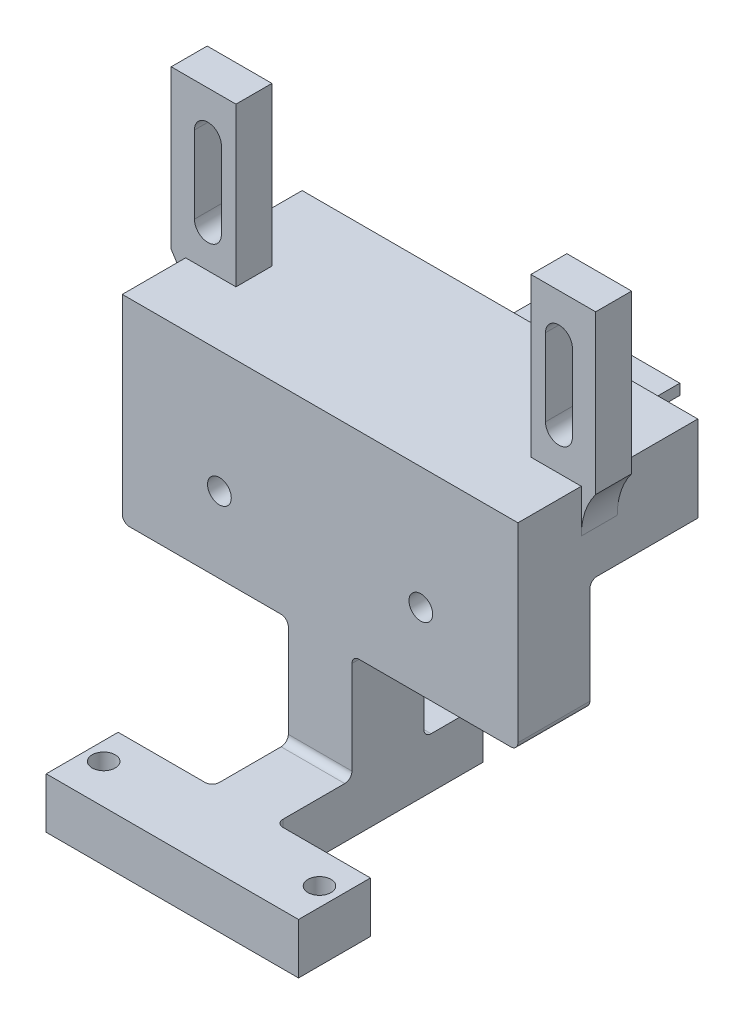
from build123d import *

# Parameters (mm, degrees)
SKETCH_1_W            = 35
SKETCH_1_H            = 40
EXTRUDE_1_DEPTH       = 5
SKETCH_2_W            = 20
SKETCH_2_H            = 20
EXTRUDE_2_DEPTH       = 65
SKETCH_3_W            = 56
SKETCH_3_H            = 11
SKETCH_3_W_2          = 4.5
CUT_EXTRUDE_1_DEPTH   = 78.821912081
SKETCH_5_W            = 55
SKETCH_5_H            = 20
EXTRUDE_3_DEPTH       = 25
SKETCH_9_R            = 1.65
CUT_EXTRUDE_3_DEPTH   = 27
SKETCH_10_W           = 55
SKETCH_10_H           = 25
EXTRUDE_4_DEPTH       = 4.9
SKETCH_11_W           = 7
SKETCH_11_H           = 5
EXTRUDE_5_DEPTH       = 21
CHAMFER_2_SIZE        = 10
CHAMFER_3_SIZE        = 3
CHAMFER_4_SIZE        = 2
CUT_EXTRUDE_7_DEPTH   = 15
SKETCH_16_W           = 12.984556049
SKETCH_16_H           = 11
EXTRUDE_6_DEPTH       = 20
CHAMFER_5_SIZE        = 3
SKETCH_19_R           = 1.6
CUT_EXTRUDE_10_DEPTH  = 10
FILLET_1_R            = 5
SKETCH_20_W           = 5
SKETCH_20_H           = 22.5
EXTRUDE_7_DEPTH       = 17.5
SKETCH_21_W           = 5
SKETCH_21_H           = 22.5
EXTRUDE_8_DEPTH       = 5
SKETCH_22_W           = 5
SKETCH_22_H           = 22.5
EXTRUDE_9_DEPTH       = 10
SKETCH_23_W           = 5
SKETCH_23_H           = 22.5
EXTRUDE_10_DEPTH      = 10
SKETCH_24_W           = 3.3
SKETCH_24_H           = 22.5
EXTRUDE_11_DEPTH      = 4
SKETCH_26_W           = 5
SKETCH_26_H           = 22.5
EXTRUDE_13_DEPTH      = 17.5
SKETCH_27_W           = 5
SKETCH_27_H           = 22.5
EXTRUDE_14_DEPTH      = 5
SKETCH_28_W           = 5
SKETCH_28_H           = 22.5
EXTRUDE_15_DEPTH      = 10
SKETCH_29_W           = 5
SKETCH_29_H           = 22.5
EXTRUDE_16_DEPTH      = 10
SKETCH_31_W           = 3.4
SKETCH_31_H           = 22.5
EXTRUDE_18_DEPTH      = 4
SKETCH_39_W           = 7.13678645
SKETCH_39_H           = 13.518332953
SKETCH_39_W_2         = 8.139264071
SKETCH_39_H_2         = 10.52230198
CUT_EXTRUDE_17_DEPTH  = 35
SKETCH_40_W           = 55
SKETCH_40_H           = 10
EXTRUDE_20_DEPTH      = 25.575713879
SKETCH_41_W           = 8.84873954
SKETCH_41_H           = 7.046133319
EXTRUDE_21_DEPTH      = 20.577981656
EXTRUDE_22_DEPTH      = 13.07563
EXTRUDE_22_DEPTH_BACK = 22
SKETCH_42_W           = 38.79276714
SKETCH_42_H           = 7.046133319
SKETCH_43_W           = 23.07563023
SKETCH_43_H           = 28.79276714
CUT_EXTRUDE_18_DEPTH  = 22
FILLET_3_R            = 1
SKETCH_46_W           = 9.238205764
SKETCH_46_H           = 22.5
EXTRUDE_26_DEPTH      = 10
CUT_EXTRUDE_19_DEPTH  = 10
SKETCH_48_R           = 1.6
CUT_EXTRUDE_20_DEPTH  = 10
CUT_EXTRUDE_21_DEPTH  = 10
SKETCH_50_W           = 2.57104036
SKETCH_50_H           = 22.5
SKETCH_50_W_2         = 2.865096637
EXTRUDE_27_DEPTH      = 10
SKETCH_53_W           = 4.304606657
SKETCH_53_H           = 10
SKETCH_53_W_2         = 2.865096637
EXTRUDE_28_DEPTH      = 11
SKETCH_51_R           = 1.6
CUT_EXTRUDE_22_DEPTH  = 12
SKETCH_52_W           = 17.2
SKETCH_52_H           = 6.8
CUT_EXTRUDE_23_DEPTH  = 39
CUT_EXTRUDE_24_DEPTH  = 10
SKETCH_55_W           = 32
SKETCH_55_H           = 22.5
EXTRUDE_29_DEPTH      = 12
SKETCH_56_W           = 10.301119562
SKETCH_56_H           = 22.5
CUT_EXTRUDE_25_DEPTH  = 7
SKETCH_57_W           = 3
SKETCH_57_H           = 4.95
EXTRUDE_30_DEPTH      = 8
SKETCH_58_W           = 9
SKETCH_58_H           = 22.5
SKETCH_58_W_2         = 8.434386946
CUT_EXTRUDE_26_DEPTH  = 10.05
CUT_EXTRUDE_27_DEPTH  = 1
SKETCH_60_W           = 2.55
SKETCH_60_H           = 22.5
EXTRUDE_31_DEPTH      = 12
SKETCH_61_W           = 3.965384327
SKETCH_61_H           = 22.5
CUT_EXTRUDE_28_DEPTH  = 6.95
SKETCH_62_W           = 5
SKETCH_62_H           = 22
EXTRUDE_32_DEPTH      = 2
SKETCH_63_W           = 5
SKETCH_63_H           = 22
EXTRUDE_33_DEPTH      = 2
SKETCH_64_W           = 5
SKETCH_64_H           = 22.5
EXTRUDE_34_DEPTH      = 8
SKETCH_65_W           = 0.1
SKETCH_65_H           = 22.5
CUT_EXTRUDE_30_DEPTH  = 15
SKETCH_66_W           = 5
SKETCH_66_H           = 22.5
EXTRUDE_35_DEPTH      = 8
SKETCH_67_R           = 1.1
CUT_EXTRUDE_31_DEPTH  = 9
SKETCH_68_W           = 0.1
SKETCH_68_H           = 22.5
CUT_EXTRUDE_32_DEPTH  = 12
SKETCH_69_W           = 12
SKETCH_69_H           = 22.5
EXTRUDE_36_DEPTH      = 5
SKETCH_70_W           = 107.728068616
SKETCH_70_H           = 75.066227262
CUT_EXTRUDE_33_DEPTH  = 130
SKETCH_73_W           = 6.7
SKETCH_73_H           = 9
CUT_EXTRUDE_34_DEPTH  = 15
FILLET_5_R            = 10
SKETCH_75_W           = 20
SKETCH_75_H           = 11.957252994
SKETCH_75_W_2         = 6.7
SKETCH_75_H_2         = 9
EXTRUDE_38_DEPTH      = 15
CUT_EXTRUDE_35_DEPTH  = 20
CUT_EXTRUDE_36_DEPTH  = 25
FILLET_6_R            = 10
CHAMFER_6_SIZE        = 5


with BuildPart() as part:
    # 草图1 → 凸台-拉伸1 (new body)
    with BuildSketch(Plane.XY):
        Rectangle(SKETCH_1_W, SKETCH_1_H)
    extrude(amount=EXTRUDE_1_DEPTH)

    # 草图2 → 凸台-拉伸2 (add)
    with BuildSketch(Plane.XY.offset(5)):
        Rectangle(SKETCH_2_W, SKETCH_2_H)
    extrude(amount=EXTRUDE_2_DEPTH)

    # 草图3 → 切除-拉伸1 (cut, through all)
    with BuildSketch(Plane.ZY.offset(10)):
        with Locations((37.5, 0)):
            Rectangle(SKETCH_3_W, SKETCH_3_H)
        with Locations((7.25, 0)):
            Rectangle(SKETCH_3_W_2, SKETCH_3_H)
    extrude(amount=-CUT_EXTRUDE_1_DEPTH, mode=Mode.SUBTRACT)

    # 草图5 → 凸台-拉伸3 (add)
    with BuildSketch(Plane.XY.offset(70)):
        Rectangle(SKETCH_5_W, SKETCH_5_H)
    extrude(amount=EXTRUDE_3_DEPTH)

    # 草图9 → 切除-拉伸3 (cut)
    with BuildSketch(Plane.XY.offset(95)):
        with Locations((-14, -3.042747006)):
            Circle(SKETCH_9_R)
        with Locations((14, -3.042747006)):
            Circle(SKETCH_9_R)
    extrude(amount=-CUT_EXTRUDE_3_DEPTH, mode=Mode.SUBTRACT)

    # 草图10 → 凸台-拉伸4 (add)
    with BuildSketch(Plane(origin=(0, 10, 0), x_dir=(1, 0, 0), z_dir=(0, 1, 0))):
        with Locations((0, -82.5)):
            Rectangle(SKETCH_10_W, SKETCH_10_H)
    extrude(amount=EXTRUDE_4_DEPTH)

    # 草图11 → 凸台-拉伸5 (add)
    with BuildSketch(Plane(origin=(0, 14.9, 0), x_dir=(1, 0, 0), z_dir=(0, 1, 0))):
        with Locations((-24, -83.7)):
            Rectangle(SKETCH_11_W, SKETCH_11_H)
        with Locations((24, -83.7)):
            Rectangle(SKETCH_11_W, SKETCH_11_H)
    extrude(amount=EXTRUDE_5_DEPTH)

    # 倒角2
    chamfer_2_edges = [part.edges().sort_by_distance(p)[0] for p in [
        (0, -5.5, 65.5),
    ]]
    chamfer(chamfer_2_edges, length=CHAMFER_2_SIZE)

    # 倒角3
    chamfer_3_edges = [part.edges().sort_by_distance(p)[0] for p in [
        (0, 10, 70),
    ]]
    chamfer(chamfer_3_edges, length=CHAMFER_3_SIZE)

    # 倒角4
    chamfer_4_edges = [part.edges().sort_by_distance(p)[0] for p in [
        (0, -10, 5),
    ]]
    chamfer(chamfer_4_edges, length=CHAMFER_4_SIZE)

    # 草图15 → 切除-拉伸7 (cut)
    with BuildSketch(Plane(origin=(0, 0, 70), x_dir=(-1, 0, 0), z_dir=(0, 0, -1))):
        Polygon((10, 1.957252994), (29.13083687, 1.957252994), (29.13083687, -8.042747006), (29.13083687, -10), (10, -10), (10, -8.042747006), align=None)
        Polygon((-29.13083687, 1.957252994), (-29.13083687, -8.042747006), (-29.13083687, -10), (-10, -10), (-10, -8.042747006), (-10, 1.957252994), align=None)
    extrude(amount=-CUT_EXTRUDE_7_DEPTH, mode=Mode.SUBTRACT)

    # 草图16 → 凸台-拉伸6 (add)
    with BuildSketch(Plane.ZY.offset(10)):
        with Locations((11.492278025, 0)):
            Rectangle(SKETCH_16_W, SKETCH_16_H)
    extrude(amount=-EXTRUDE_6_DEPTH)

    # 倒角5
    chamfer_5_edges = [part.edges().sort_by_distance(p)[0] for p in [
        (0, 5.5, 17.984556049),
    ]]
    chamfer(chamfer_5_edges, length=CHAMFER_5_SIZE)

    # 草图19 → 切除-拉伸10 (cut)
    with BuildSketch(Plane.XY.offset(86.2)):
        with Locations((-24.4, 29.9)):
            Circle(SKETCH_19_R)
        with Locations((-24.4, 19.9)):
            Circle(SKETCH_19_R)
        with Locations((24.4, 19.9)):
            Circle(SKETCH_19_R)
        with Locations((24.4, 29.9)):
            Circle(SKETCH_19_R)
    extrude(amount=-CUT_EXTRUDE_10_DEPTH, mode=Mode.SUBTRACT)

    # 圆角1
    fillet_1_edges = [part.edges().sort_by_distance(p)[0] for p in [
        (17.5, -20, 2.5),
        (-17.5, -20, 2.5),
        (-17.5, 20, 2.5),
        (17.5, 20, 2.5),
    ]]
    fillet(fillet_1_edges, radius=FILLET_1_R)

    # 草图20 → 凸台-拉伸7 (add)
    with BuildSketch(Plane.ZY.offset(17.5)):
        with Locations((2.5, 0)):
            Rectangle(SKETCH_20_W, SKETCH_20_H)
    extrude(amount=EXTRUDE_7_DEPTH)

    # 草图21 → 凸台-拉伸8 (add)
    with BuildSketch(Plane.ZY.offset(35)):
        with Locations((2.5, 0)):
            Rectangle(SKETCH_21_W, SKETCH_21_H)
    extrude(amount=EXTRUDE_8_DEPTH)

    # 草图22 → 凸台-拉伸9 (add)
    with BuildSketch(Plane(origin=(0, 0, 0), x_dir=(-1, 0, 0), z_dir=(0, 0, -1))):
        with Locations((37.5, 0)):
            Rectangle(SKETCH_22_W, SKETCH_22_H)
    extrude(amount=EXTRUDE_9_DEPTH)

    # 草图23 → 凸台-拉伸10 (add)
    with BuildSketch(Plane(origin=(0, 0, 0), x_dir=(-1, 0, 0), z_dir=(0, 0, -1))):
        with Locations((15.5, 0)):
            Rectangle(SKETCH_23_W, SKETCH_23_H)
    extrude(amount=EXTRUDE_10_DEPTH)

    # 草图24 → 凸台-拉伸11 (add)
    with BuildSketch(Plane.ZY.offset(18)):
        with Locations((-8.35, 0)):
            Rectangle(SKETCH_24_W, SKETCH_24_H)
    extrude(amount=EXTRUDE_11_DEPTH)

    # 草图26 → 凸台-拉伸13 (add)
    with BuildSketch(Plane(origin=(17.5, 0, 0), x_dir=(0, 0, -1), z_dir=(1, 0, 0))):
        with Locations((-2.5, 0)):
            Rectangle(SKETCH_26_W, SKETCH_26_H)
    extrude(amount=EXTRUDE_13_DEPTH)

    # 草图27 → 凸台-拉伸14 (add)
    with BuildSketch(Plane(origin=(35, 0, 0), x_dir=(0, 0, -1), z_dir=(1, 0, 0))):
        with Locations((-2.5, 0)):
            Rectangle(SKETCH_27_W, SKETCH_27_H)
    extrude(amount=EXTRUDE_14_DEPTH)

    # 草图28 → 凸台-拉伸15 (add)
    with BuildSketch(Plane(origin=(0, 0, 0), x_dir=(-1, 0, 0), z_dir=(0, 0, -1))):
        with Locations((-37.5, 0)):
            Rectangle(SKETCH_28_W, SKETCH_28_H)
    extrude(amount=EXTRUDE_15_DEPTH)

    # 草图29 → 凸台-拉伸16 (add)
    with BuildSketch(Plane(origin=(0, 0, 0), x_dir=(-1, 0, 0), z_dir=(0, 0, -1))):
        with Locations((-15.5, 0)):
            Rectangle(SKETCH_29_W, SKETCH_29_H)
    extrude(amount=EXTRUDE_16_DEPTH)

    # 草图31 → 凸台-拉伸18 (add)
    with BuildSketch(Plane(origin=(18, 0, 0), x_dir=(0, 0, -1), z_dir=(1, 0, 0))):
        with Locations((8.3, 0)):
            Rectangle(SKETCH_31_W, SKETCH_31_H)
    extrude(amount=EXTRUDE_18_DEPTH)

    # 草图39 → 切除-拉伸17 (cut)
    with BuildSketch(Plane.ZY.offset(17.5)):
        with Locations((3.568393225, 18.009166476)):
            Rectangle(SKETCH_39_W, SKETCH_39_H)
        with Locations((4.069632036, -16.51115099)):
            Rectangle(SKETCH_39_W_2, SKETCH_39_H_2)
    extrude(amount=-CUT_EXTRUDE_17_DEPTH, mode=Mode.SUBTRACT)

    # 草图40 → 凸台-拉伸20 (add)
    with BuildSketch(Plane.XZ.offset(10)):
        with Locations((0, 90)):
            Rectangle(SKETCH_40_W, SKETCH_40_H)
    extrude(amount=EXTRUDE_20_DEPTH)

    # 草图41 → 凸台-拉伸21 (add)
    with BuildSketch(Plane.XY.offset(95)):
        with Locations((0, -32.05264722)):
            Rectangle(SKETCH_41_W, SKETCH_41_H)
    extrude(amount=EXTRUDE_21_DEPTH)

    # 草图42 → 凸台-拉伸22 (add, two sides: drawn at the far end of the back side and taken through both)
    with BuildSketch(Plane.ZY.offset(4.42436977).offset(-EXTRUDE_22_DEPTH_BACK)):
        with Locations((96.181598086, -32.05264722)):
            Rectangle(SKETCH_42_W, SKETCH_42_H)
    extrude(amount=EXTRUDE_22_DEPTH + EXTRUDE_22_DEPTH_BACK)

    # 草图43 → 切除-拉伸18 (cut)
    with BuildSketch(Plane.XZ.offset(35.575713879)):
        with Locations((15.962184885, 91.181598086)):
            Rectangle(SKETCH_43_W, SKETCH_43_H)
        with Locations((-15.962184885, 91.181598086)):
            Rectangle(SKETCH_43_W, SKETCH_43_H)
    extrude(amount=-CUT_EXTRUDE_18_DEPTH, mode=Mode.SUBTRACT)

    # 圆角3
    fillet_3_edges = [part.edges().sort_by_distance(p)[0] for p in [
        (-18.75, 1.957252994, 85),
        (18.75, 1.957252994, 85),
        (0, -10, 85),
        (0, -28.52958056, 85),
        (0, -28.52958056, 95),
        (4.42436977, -32.052647219, 105.577981656),
        (27.5, -13.575713879, 90),
        (4.42436977, -13.575713879, 90),
        (-27.5, -13.575713879, 90),
        (-4.42436977, -32.052647219, 105.577981656),
        (-4.42436977, -13.575713879, 90),
    ]]
    fillet(fillet_3_edges, radius=FILLET_3_R)

    # 草图46 → 凸台-拉伸26 (add)
    with BuildSketch(Plane(origin=(0, 0, 0), x_dir=(-1, 0, 0), z_dir=(0, 0, -1))):
        with Locations((-8.380897118, 0)):
            Rectangle(SKETCH_46_W, SKETCH_46_H)
    extrude(amount=EXTRUDE_26_DEPTH)

    # 草图47 → 切除-拉伸19 (cut)
    with BuildSketch(Plane(origin=(0, 0, -10), x_dir=(-1, 0, 0), z_dir=(0, 0, -1))):
        with BuildLine():
            Line((-8.066400893, 11.25), (-10.700516417, 11.25))
            Line((-10.700516417, 11.25), (-10.700516417, -11.25))
            Line((-10.700516417, -11.25), (-6.332834596, -11.25))
            ThreePointArc((-6.332834596, -11.25), (-6.663682414, -9.62836823), (-8.066400893, -8.75))
            Line((-8.066400893, -8.75), (-8.066400893, -7.900028072))
            ThreePointArc((-8.066400893, -7.900028072), (-6.289381928, -5.825014036), (-8.066400893, -3.75))
            Line((-8.066400893, -3.75), (-8.066400893, -2.900028072))
            ThreePointArc((-8.066400893, -2.900028072), (-6.289381928, -0.825014036), (-8.066400893, 1.25))
            Line((-8.066400893, 1.25), (-8.066400893, 2.099971928))
            ThreePointArc((-8.066400893, 2.099971928), (-6.289381928, 4.174985964), (-8.066400893, 6.25))
            Line((-8.066400893, 6.25), (-8.066400893, 7.099971928))
            ThreePointArc((-8.066400893, 7.099971928), (-6.289381928, 9.174985964), (-8.066400893, 11.25))
        make_face()
    extrude(amount=-CUT_EXTRUDE_19_DEPTH, mode=Mode.SUBTRACT)

    # 草图48 → 切除-拉伸20 (cut)
    with BuildSketch(Plane(origin=(0, -28.52958056, 0), x_dir=(1, 0, 0), z_dir=(0, 1, 0))):
        with Locations(Location((15, -110.089556655, 0), (0, 0, 270))):
            Circle(SKETCH_48_R)
        with Locations(Location((-15, -110.089556655, 0), (0, 0, 270))):
            Circle(SKETCH_48_R)
    extrude(amount=-CUT_EXTRUDE_20_DEPTH, mode=Mode.SUBTRACT)

    # 草图49 → 切除-拉伸21 (cut)
    with BuildSketch(Plane.XY.offset(86.2)):
        with BuildLine():
            Line((-22.528691915, 29.9), (-22.528691915, 19.165676086))
            ThreePointArc((-22.528691915, 19.165676086), (-24.4, 17.294368), (-26.271308085, 19.165676086))
            Line((-26.271308085, 19.165676086), (-26.271308085, 29.9))
            ThreePointArc((-26.271308085, 29.9), (-24.4, 31.771308085), (-22.528691915, 29.9))
        make_face()
        with BuildLine():
            Line((22.528691915, 29.9), (22.528691915, 19.165676086))
            ThreePointArc((22.528691915, 19.165676086), (24.4, 17.294368), (26.271308085, 19.165676086))
            Line((26.271308085, 19.165676086), (26.271308085, 29.9))
            ThreePointArc((26.271308085, 29.9), (24.4, 31.771308085), (22.528691915, 29.9))
        make_face()
    extrude(amount=-CUT_EXTRUDE_21_DEPTH, mode=Mode.SUBTRACT)

    # 草图50 → 凸台-拉伸27 (add)
    with BuildSketch(Plane(origin=(0, 0, -10), x_dir=(-1, 0, 0), z_dir=(0, 0, -1))):
        with Locations((-5.047314416, 0)):
            Rectangle(SKETCH_50_W, SKETCH_50_H)
        with Locations((-12.133064736, 0)):
            Rectangle(SKETCH_50_W_2, SKETCH_50_H)
    extrude(amount=EXTRUDE_27_DEPTH)

    # 草图53 → 凸台-拉伸28 (add)
    with BuildSketch(Plane(origin=(0, 11.25, 0), x_dir=(1, 0, 0), z_dir=(0, 1, 0))):
        with Locations((5.914097565, 5)):
            Rectangle(SKETCH_53_W, SKETCH_53_H)
        with Locations((12.133064736, 5)):
            Rectangle(SKETCH_53_W_2, SKETCH_53_H)
    extrude(amount=EXTRUDE_28_DEPTH)

    # 草图51 → 切除-拉伸22 (cut)
    with BuildSketch(Plane(origin=(13.565613054, 0, 0), x_dir=(0, 0, -1), z_dir=(1, 0, 0))):
        with Locations((16, 6.25)):
            Circle(SKETCH_51_R)
        with Locations((16, -6.25)):
            Circle(SKETCH_51_R)
    extrude(amount=-CUT_EXTRUDE_22_DEPTH, mode=Mode.SUBTRACT)

    # 草图52 → 切除-拉伸23 (cut)
    with BuildSketch(Plane(origin=(0, 11.25, 0), x_dir=(1, 0, 0), z_dir=(0, 1, 0))):
        with Locations((-26.5, 3.35)):
            Rectangle(SKETCH_52_W, SKETCH_52_H)
        with Locations((26.5, 3.35)):
            Rectangle(SKETCH_52_W, SKETCH_52_H)
    extrude(amount=-CUT_EXTRUDE_23_DEPTH, mode=Mode.SUBTRACT)

    # 草图54 → 切除-拉伸24 (cut)
    with BuildSketch(Plane(origin=(0, 0, -10), x_dir=(-1, 0, 0), z_dir=(0, 0, -1))):
        with BuildLine():
            ThreePointArc((-8.066400893, 12.099971928), (-6.289381928, 14.174985964), (-8.066400893, 16.25))
            Line((-8.066400893, 16.25), (-8.066400893, 12.099971928))
        make_face()
        with BuildLine():
            ThreePointArc((-8.066400893, 17.099971928), (-6.289381928, 19.174985964), (-8.066400893, 21.25))
            Line((-8.066400893, 21.25), (-8.066400893, 17.099971928))
        make_face()
    extrude(amount=-CUT_EXTRUDE_24_DEPTH, mode=Mode.SUBTRACT)

    # 草图55 → 凸台-拉伸29 (add)
    with BuildSketch(Plane.XY.offset(5)):
        Rectangle(SKETCH_55_W, SKETCH_55_H)
    extrude(amount=EXTRUDE_29_DEPTH)

    # 草图56 → 切除-拉伸25 (cut)
    with BuildSketch(Plane(origin=(0, 0, 0), x_dir=(-1, 0, 0), z_dir=(0, 0, -1))):
        with Locations((7.849440219, 0)):
            Rectangle(SKETCH_56_W, SKETCH_56_H)
    extrude(amount=-CUT_EXTRUDE_25_DEPTH, mode=Mode.SUBTRACT)

    # 草图57 → 凸台-拉伸30 (add)
    with BuildSketch(Plane(origin=(0, 11.25, 0), x_dir=(1, 0, 0), z_dir=(0, 1, 0))):
        with Locations((-18.465384327, -2.525)):
            Rectangle(SKETCH_57_W, SKETCH_57_H)
        with Locations((-34.665384327, -2.525)):
            Rectangle(SKETCH_57_W, SKETCH_57_H)
    extrude(amount=EXTRUDE_30_DEPTH)

    # 草图58 → 切除-拉伸26 (cut)
    with BuildSketch(Plane(origin=(0, 0, -10), x_dir=(-1, 0, 0), z_dir=(0, 0, -1))):
        with Locations((17.5, 0)):
            Rectangle(SKETCH_58_W, SKETCH_58_H)
        with Locations((-17.782806527, 0)):
            Rectangle(SKETCH_58_W_2, SKETCH_58_H)
    extrude(amount=-CUT_EXTRUDE_26_DEPTH, mode=Mode.SUBTRACT)

    # 草图59 → 切除-拉伸27 (cut)
    with BuildSketch(Plane(origin=(0, 14.9, 0), x_dir=(1, 0, 0), z_dir=(0, 1, 0))):
        Polygon((20.5, -86.2), (20.5, -81.2), (27.5, -81.2), (27.5, -70), (-27.5, -70), (-27.5, -81.2), (-20.5, -81.2), (-20.5, -86.2), (-27.5, -86.2), (-27.5, -95), (27.5, -95), (27.5, -86.2), align=None)
    extrude(amount=-CUT_EXTRUDE_27_DEPTH, mode=Mode.SUBTRACT)

    # 草图60 → 凸台-拉伸31 (add)
    with BuildSketch(Plane.XY.offset(5)):
        with Locations((-17.275, 0)):
            Rectangle(SKETCH_60_W, SKETCH_60_H)
        with Locations((17.275, 0)):
            Rectangle(SKETCH_60_W, SKETCH_60_H)
    extrude(amount=EXTRUDE_31_DEPTH)

    # 草图61 → 切除-拉伸28 (cut)
    with BuildSketch(Plane(origin=(0, 0, 0.05), x_dir=(-1, 0, 0), z_dir=(0, 0, -1))):
        with Locations((14.982692164, 0)):
            Rectangle(SKETCH_61_W, SKETCH_61_H)
    extrude(amount=-CUT_EXTRUDE_28_DEPTH, mode=Mode.SUBTRACT)

    # 草图62 → 凸台-拉伸32 (add)
    with BuildSketch(Plane.ZY.offset(27.5)):
        with Locations((83.7, 24.9)):
            Rectangle(SKETCH_62_W, SKETCH_62_H)
    extrude(amount=EXTRUDE_32_DEPTH)

    # 草图63 → 凸台-拉伸33 (add)
    with BuildSketch(Plane(origin=(27.5, 0, 0), x_dir=(0, 0, -1), z_dir=(1, 0, 0))):
        with Locations((-83.7, 24.9)):
            Rectangle(SKETCH_63_W, SKETCH_63_H)
    extrude(amount=EXTRUDE_33_DEPTH)

    # 草图64 → 凸台-拉伸34 (add)
    with BuildSketch(Plane(origin=(0, 0, -10), x_dir=(-1, 0, 0), z_dir=(0, 0, -1))):
        with Locations((-37.5, 0)):
            Rectangle(SKETCH_64_W, SKETCH_64_H)
    extrude(amount=EXTRUDE_34_DEPTH)

    # 草图65 → 切除-拉伸30 (cut)
    with BuildSketch(Plane(origin=(0, 0, -18), x_dir=(-1, 0, 0), z_dir=(0, 0, -1))):
        with Locations((-35.05, 0)):
            Rectangle(SKETCH_65_W, SKETCH_65_H)
    extrude(amount=-CUT_EXTRUDE_30_DEPTH, mode=Mode.SUBTRACT)

    # 草图66 → 凸台-拉伸35 (add)
    with BuildSketch(Plane(origin=(0, 0, -10), x_dir=(-1, 0, 0), z_dir=(0, 0, -1))):
        with Locations((37.5, 0)):
            Rectangle(SKETCH_66_W, SKETCH_66_H)
    extrude(amount=EXTRUDE_35_DEPTH)

    # 草图67 → 切除-拉伸31 (cut)
    with BuildSketch(Plane(origin=(40, 0, 0), x_dir=(0, 0, -1), z_dir=(1, 0, 0))):
        with Locations(Location((2.45, 4.25, 0), (0, 0, 90))):
            Circle(SKETCH_67_R)
        with Locations(Location((2.45, -3.75, 0), (0, 0, 90))):
            Circle(SKETCH_67_R)
        with Locations(Location((14.45, -3.75, 0), (0, 0, 90))):
            Circle(SKETCH_67_R)
        with Locations(Location((14.45, 4.25, 0), (0, 0, 90))):
            Circle(SKETCH_67_R)
    cut_extrude_31 = extrude(amount=-CUT_EXTRUDE_31_DEPTH, mode=Mode.SUBTRACT)

    # 镜向1: 切除-拉伸31 across plane
    add(cut_extrude_31.mirror(Plane(origin=(0, 0, 0), x_dir=(0, 0, 1), z_dir=(1, 0, 0))), mode=Mode.SUBTRACT)

    # 草图68 → 切除-拉伸32 (cut)
    with BuildSketch(Plane(origin=(0, 0, -18), x_dir=(-1, 0, 0), z_dir=(0, 0, -1))):
        with Locations((35.05, 0)):
            Rectangle(SKETCH_68_W, SKETCH_68_H)
    extrude(amount=-CUT_EXTRUDE_32_DEPTH, mode=Mode.SUBTRACT)

    # 草图69 → 凸台-拉伸36 (add)
    with BuildSketch(Plane.ZY.offset(18.55)):
        with Locations((11, 0)):
            Rectangle(SKETCH_69_W, SKETCH_69_H)
    extrude(amount=EXTRUDE_36_DEPTH)

    # 草图70 → 切除-拉伸33 (cut)
    with BuildSketch(Plane(origin=(0, 0, 70), x_dir=(-1, 0, 0), z_dir=(0, 0, -1))):
        Rectangle(SKETCH_70_W, SKETCH_70_H)
    extrude(amount=CUT_EXTRUDE_33_DEPTH, mode=Mode.SUBTRACT)

    # 草图73 → 切除-拉伸34 (cut)
    with BuildSketch(Plane(origin=(0, 0, 70), x_dir=(-1, 0, 0), z_dir=(0, 0, -1))):
        with Locations((0, -4.021373503)):
            Rectangle(SKETCH_73_W, SKETCH_73_H)
    extrude(amount=-CUT_EXTRUDE_34_DEPTH, mode=Mode.SUBTRACT)

    # 圆角5
    # the kernel refuses this fillet: 10 mm, written as the material it adds along each edge
    with BuildSketch(Plane(origin=(-27.5, 13.9, 86.2), x_dir=(0, -1, 0), z_dir=(0, 0, -1)), Plane(origin=(27.5, 13.9, 81.2), x_dir=(0, -1, 0), z_dir=(0, 0, 1))) as fillet_5_piece_1:
        with BuildLine():
            CenterArc((6, 10), FILLET_5_R, 233.130102354, 36.869897646)
            Line((0, 2), (0, 0))
            Line((0, 0), (6, 0))
        make_face()
    extrude(amount=5)

    # 草图75 → 凸台-拉伸38 (add)
    with BuildSketch(Plane(origin=(0, 0, 70), x_dir=(-1, 0, 0), z_dir=(0, 0, -1))):
        with Locations((0, -4.021373503)):
            Rectangle(SKETCH_75_W, SKETCH_75_H)
        with Locations((0, -4.021373503)):
            Rectangle(SKETCH_75_W_2, SKETCH_75_H_2, mode=Mode.SUBTRACT)
    extrude(amount=EXTRUDE_38_DEPTH)

    # 草图74 → 切除-拉伸35 (cut)
    with BuildSketch(Plane(origin=(10, 0, 0), x_dir=(0, 0, -1), z_dir=(1, 0, 0))):
        with BuildLine():
            Line((-82.596309624, -2.921373503), (-58.15800679, -2.921373503))
            ThreePointArc((-58.15800679, -2.921373503), (-57.05800679, -4.021373503), (-58.15800679, -5.121373503))
            Line((-58.15800679, -5.121373503), (-82.596309624, -5.121373503))
            ThreePointArc((-82.596309624, -5.121373503), (-83.696309624, -4.021373503), (-82.596309624, -2.921373503))
        make_face()
    extrude(amount=-CUT_EXTRUDE_35_DEPTH, mode=Mode.SUBTRACT)

    # 草图76 → 切除-拉伸36 (cut)
    with BuildSketch(Plane(origin=(0, 0, 55), x_dir=(-1, 0, 0), z_dir=(0, 0, -1))):
        Polygon((-6.35, 0.478626497), (-6.35, -8.521373503), (6.35, -8.521373503), (6.35, 0.478626497), (10, 0.478626497), (10, -10), (-10, -10), (-10, 0.478626497), align=None)
    extrude(amount=-CUT_EXTRUDE_36_DEPTH, mode=Mode.SUBTRACT)

    # 圆角6
    # the kernel refuses this fillet: 10 mm, written as the material it adds along each edge
    with BuildSketch(Plane(origin=(-6.35, -2.921373503, 80), x_dir=(-1, 0, 0), z_dir=(0, 1, 0)), Plane(origin=(6.35, 0.478626497, 80), x_dir=(1, 0, 0), z_dir=(0, -1, 0))) as fillet_6_piece_1:
        with BuildLine():
            CenterArc((10, -7.725121358), FILLET_6_R, 129.419984467, 50.580015533)
            Line((0, -7.725121358), (0, 0))
            Line((0, 0), (3.65, 0))
        make_face()
    extrude(amount=3.4)

    # 倒角6
    chamfer_6_edges = [part.edges().sort_by_distance(p)[0] for p in [
        (0, 1.957252994, 70),
    ]]
    chamfer(chamfer_6_edges, length=CHAMFER_6_SIZE)


solid = part.part
